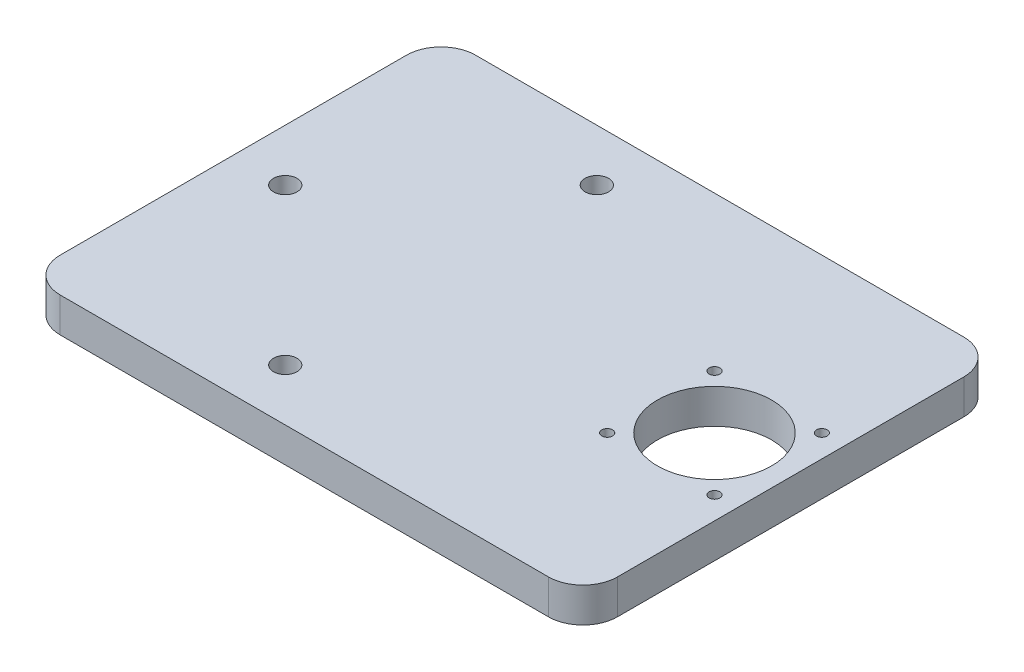
from build123d import *

# Parameters (mm, degrees)
SKETCH_1_W          = 161
SKETCH_1_H          = 120
EXTRUDE_1_DEPTH     = 10
FILLET_1_R          = 10
SKETCH_2_R          = 1.55
CUT_EXTRUDE_1_DEPTH = 10
SKETCH_3_R          = 16.5
CUT_EXTRUDE_2_DEPTH = 10
SKETCH_4_R          = 3.4
CUT_EXTRUDE_3_DEPTH = 101.897224937


with BuildPart() as part:
    # 草图1 → 凸台-拉伸1 (new body)
    with BuildSketch(Plane(origin=(0, 0, 0), x_dir=(1, 0, 0), z_dir=(0, 1, 0))):
        Rectangle(SKETCH_1_W, SKETCH_1_H)
    extrude(amount=EXTRUDE_1_DEPTH)

    # 圆角1
    fillet_1_edges = [part.edges().sort_by_distance(p)[0] for p in [
        (80.5, 5, 60),
        (80.5, 5, -60),
        (-80.5, 5, -60),
        (-80.5, 5, 60),
    ]]
    fillet(fillet_1_edges, radius=FILLET_1_R)

    # 草图2 → 切除-拉伸1 (cut)
    with BuildSketch(Plane(origin=(0, 10, 0), x_dir=(1, 0, 0), z_dir=(0, 1, 0))):
        with Locations((74, 15.5)):
            Circle(SKETCH_2_R)
        with Locations((74, -15.5)):
            Circle(SKETCH_2_R)
        with Locations((43, 15.5)):
            Circle(SKETCH_2_R)
        with Locations((43, -15.5)):
            Circle(SKETCH_2_R)
    extrude(amount=-CUT_EXTRUDE_1_DEPTH, mode=Mode.SUBTRACT)

    # 草图3 → 切除-拉伸2 (cut)
    with BuildSketch(Plane.XZ):
        with Locations((58.5, 0)):
            Circle(SKETCH_3_R)
    extrude(amount=-CUT_EXTRUDE_2_DEPTH, mode=Mode.SUBTRACT)

    # 草图4 → 切除-拉伸3 (cut, through all)
    with BuildSketch(Plane.XZ):
        with Locations((-20.5, 45)):
            Circle(SKETCH_4_R)
        with Locations((-65.5, 0)):
            Circle(SKETCH_4_R)
        with Locations((-20.5, -45)):
            Circle(SKETCH_4_R)
    extrude(amount=-CUT_EXTRUDE_3_DEPTH, mode=Mode.SUBTRACT)


solid = part.part
